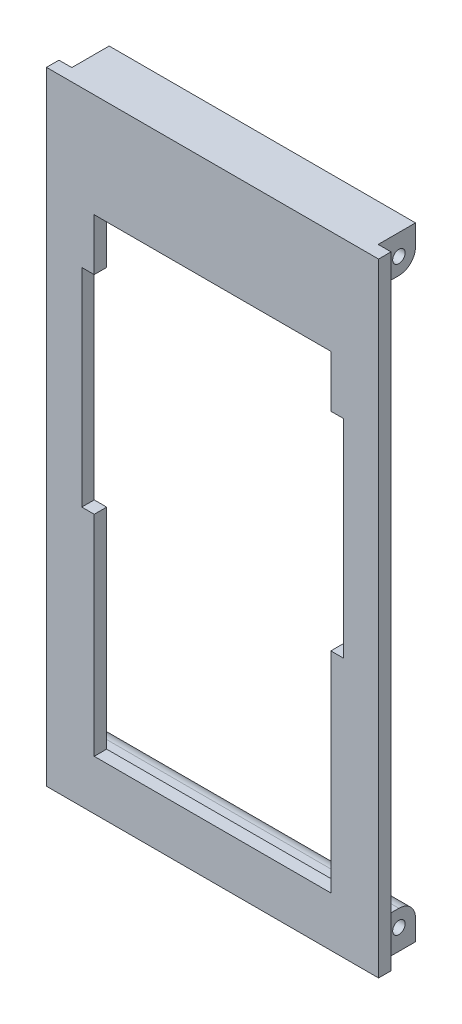
from build123d import *

# Parameters (mm, degrees)
SKETCH3_R           = 1.5
BOSS_EXTRUDE3_DEPTH = 80
CUT_EXTRUDE1_DEPTH  = 171.423003142
SKETCH5_W           = 3.1
SKETCH5_H           = 9
CUT_EXTRUDE2_DEPTH  = 171.423003142
FILLET1_R           = 4


with BuildPart() as part:
    # Sketch3 → Boss-Extrude3 (new body)
    with BuildSketch(Plane(origin=(0, 0, 0), x_dir=(0, 0, -1), z_dir=(1, 0, 0))):
        Polygon((0, 150), (12, 150), (12, 141), (3, 141), (3, 9), (12, 9), (12, 0), (0, 0), align=None)
        with Locations((8, 145)):
            Circle(SKETCH3_R, mode=Mode.SUBTRACT)
        with Locations((8, 5)):
            Circle(SKETCH3_R, mode=Mode.SUBTRACT)
    extrude(amount=BOSS_EXTRUDE3_DEPTH)

    # Sketch4 → Cut-Extrude1 (cut, through all)
    with BuildSketch(Plane.XY):
        Polygon((11.5, 112.5), (11.5, 125), (68.5, 125), (68.5, 112.5), (71.5, 112.5), (71.5, 62.5), (68.5, 62.5), (68.5, 12), (11.5, 12), (11.5, 62.5), (8.5, 62.5), (8.5, 112.5), align=None)
    extrude(amount=-CUT_EXTRUDE1_DEPTH, mode=Mode.SUBTRACT)

    # Sketch5 → Cut-Extrude2 (cut, through all)
    with BuildSketch(Plane(origin=(0, 0, 0), x_dir=(1, 0, 0), z_dir=(0, 1, 0))):
        with Locations((78.45, 7.5)):
            Rectangle(SKETCH5_W, SKETCH5_H)
        with Locations((1.55, 7.5)):
            Rectangle(SKETCH5_W, SKETCH5_H)
    extrude(amount=CUT_EXTRUDE2_DEPTH, mode=Mode.SUBTRACT)

    # Fillet1
    fillet1_edges = [part.edges().sort_by_distance(p)[0] for p in [
        (40, 141, -12),
        (40, 9, -12),
    ]]
    fillet(fillet1_edges, radius=FILLET1_R)


solid = part.part
